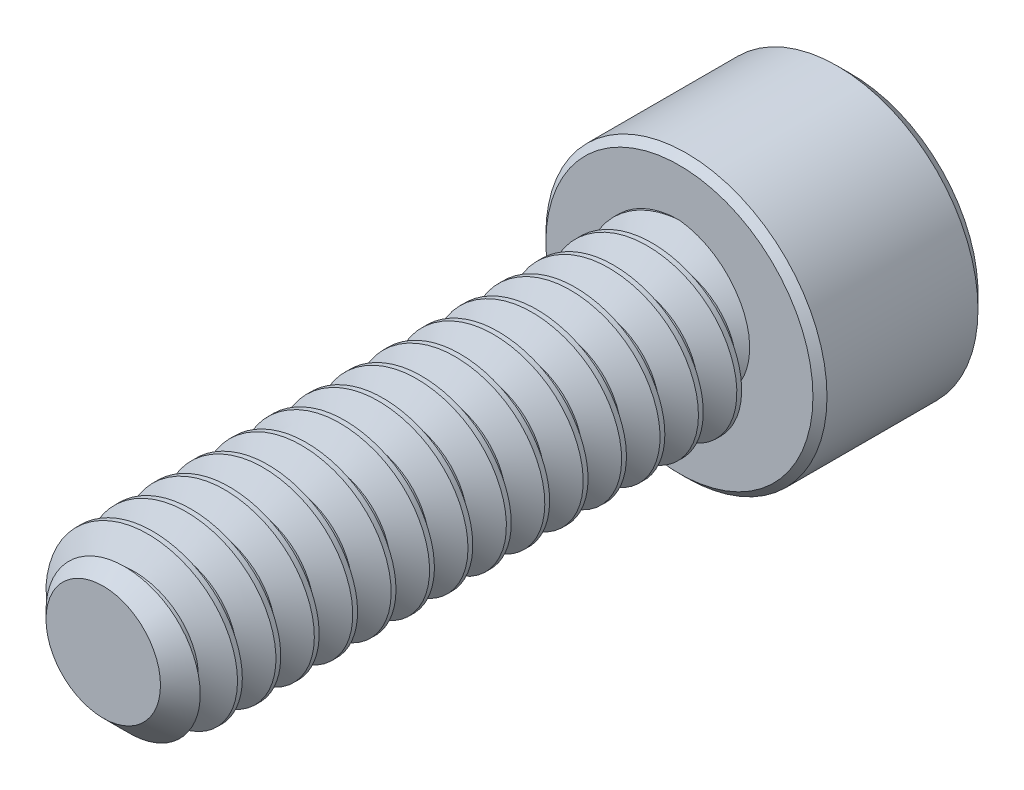
from build123d import *

# Parameters (mm, degrees)
SKETCH1_R          = 1.4224
EXTRUDE1_DEPTH     = 9.525
CHAMFER3_SIZE      = 0.47625
CUT_SWEEP1_PITCH   = 0.635
SKETCH6_R          = 2.3241
EXTRUDE2_DEPTH     = 2.8448
CUT_EXTRUDE1_DEPTH = 1.7859375
CHAMFER1_SIZE      = 0.23241
CHAMFER2_SIZE      = 0.116205


with BuildPart() as part:
    # Sketch1 → Extrude1 (new body)
    with BuildSketch(Plane.XY):
        Circle(SKETCH1_R)
    extrude(amount=-EXTRUDE1_DEPTH)

    # Chamfer3
    chamfer3_edges = [part.edges().sort_by_distance(p)[0] for p in [
        (-1.4224, 0, 0),
    ]]
    chamfer(chamfer3_edges, length=CHAMFER3_SIZE)

    # Cut-Sweep1: the profile of Sketch3 profile screwed along a right-hand helix of 16 turns, 6 arcs to a turn; built about Z, then put on its axis
    cut_sweep1_z = Axis((0, 0, 0), (0, 0, 1))
    cut_sweep1_corners = [(1.4227, 0, -0.555798205), (1.009955401, 0, -0.3175), (1.009955401, 0, -0.238125), (1.4227, 0, 0.000173205)]
    with BuildLine(mode=Mode.PRIVATE) as cut_sweep1_profile:
        Line(cut_sweep1_corners[0], cut_sweep1_corners[1])
        Line(cut_sweep1_corners[1], cut_sweep1_corners[2])
        Line(cut_sweep1_corners[2], cut_sweep1_corners[3])
        Line(cut_sweep1_corners[3], cut_sweep1_corners[0])
    cut_sweep1_cap = Face(cut_sweep1_profile.wire())
    cut_sweep1_turn_angles = [0, 30, 60, 90, 120, 150, 180, 210, 240, 270, 300, 330, 360]
    cut_sweep1_turn_weights = [1, 0.8660254037844387, 1, 0.8660254037844387, 1, 0.8660254037844387, 1, 0.8660254037844387, 1, 0.8660254037844387, 1, 0.8660254037844387, 1]
    cut_sweep1_turn_rails = [Edge.make_bspline([Vector(p[0], p[1], 0).rotate(cut_sweep1_z, cut_sweep1_turn_angles[k]) / cut_sweep1_turn_weights[k] + Vector(0, 0, p[2] + CUT_SWEEP1_PITCH * cut_sweep1_turn_angles[k] / 360) for k in range(13)], [0, 0, 0, 1, 1, 2, 2, 3, 3, 4, 4, 5, 5, 6, 6, 6], 2, cut_sweep1_turn_weights) for p in cut_sweep1_corners]
    cut_sweep1_turn_sides = [Face.make_surface_from_curves(cut_sweep1_turn_rails[p[0]], cut_sweep1_turn_rails[p[1]]) for p in [(0, 1), (1, 2), (2, 3), (3, 0)]]
    cut_sweep1 = Plane(origin=(0, 0, 0), x_dir=(0, 1, 0), z_dir=(0, 0, -1)) * Solid(Shell([*[p.moved(Location((0, 0, CUT_SWEEP1_PITCH * i))) for i in range(16) for p in cut_sweep1_turn_sides], cut_sweep1_cap, cut_sweep1_cap.rotate(cut_sweep1_z, 5760).moved(Location((0, 0, CUT_SWEEP1_PITCH * 5760 / 360)))]))
    add(cut_sweep1, mode=Mode.SUBTRACT)

    # Sketch6 → Extrude2 (add)
    with BuildSketch(Plane(origin=(0, 0, -9.525), x_dir=(-1, 0, 0), z_dir=(0, 0, -1))):
        Circle(SKETCH6_R)
    extrude(amount=EXTRUDE2_DEPTH)

    # Sketch7 → Cut-Extrude1 (cut)
    with BuildSketch(Plane(origin=(0, 0, -12.3698), x_dir=(-1, 0, 0), z_dir=(0, 0, -1))):
        Polygon((0, 1.374815329), (-1.190625, 0.687407664), (-1.190625, -0.687407664), (0, -1.374815329), (1.190625, -0.687407664), (1.190625, 0.687407664), align=None)
    extrude(amount=-CUT_EXTRUDE1_DEPTH, mode=Mode.SUBTRACT)

    # Cut-Extrude2 cone 1 section (through the dimple's axis) → Cut-Extrude2 (revolve, cut)
    with BuildSketch(Plane(origin=(0, 0, -12.3698), x_dir=(0, 1, 0), z_dir=(1, 0, 0))):
        Polygon((0, 0), (1.374815329, 0), (0, 1.374815329), align=None)
    revolve(axis=Axis((0, 0, -12.3698), (0, 0, 1)), mode=Mode.SUBTRACT)

    # Chamfer1
    chamfer1_edges = [part.edges().sort_by_distance(p)[0] for p in [
        (2.3241, 0, -12.3698),
    ]]
    chamfer(chamfer1_edges, length=CHAMFER1_SIZE)

    # Chamfer2
    chamfer2_edges = [part.edges().sort_by_distance(p)[0] for p in [
        (2.3241, 0, -9.525),
    ]]
    chamfer(chamfer2_edges, length=CHAMFER2_SIZE)


solid = part.part
